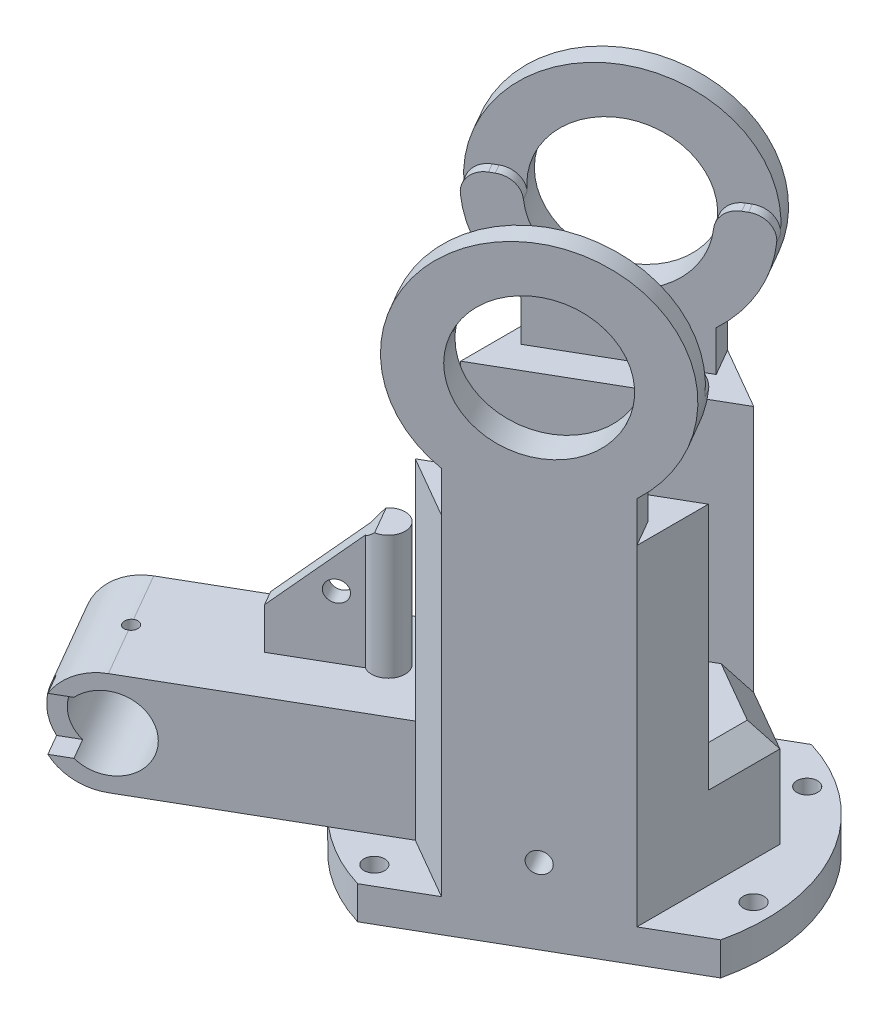
from build123d import *

# Parameters (mm, degrees)
SKETCH4_R            = 55.88
BOSS_EXTRUDE2_DEPTH  = 10.16
BOSS_EXTRUDE4_DEPTH  = 101.6
BOSS_EXTRUDE5_DEPTH  = 9.525
BOSS_EXTRUDE6_START  = -9.525
BOSS_EXTRUDE6_DEPTH  = 9.525
CUT_EXTRUDE4_REACH   = 223.16
SKETCH12_R           = 21.5
SKETCH13_W           = 38.1
SKETCH13_H           = 69.85
CUT_EXTRUDE5_DEPTH   = 76.2
BOSS_EXTRUDE10_DEPTH = 19.05
SKETCH28_R           = 11.2395
CUT_EXTRUDE9_DEPTH   = 38.1
CUT_EXTRUDE10_DEPTH  = 7.366
CHAMFER1_SIZE        = 6.35
SKETCH30_R           = 2.1
CUT_EXTRUDE11_DEPTH  = 7.366
SKETCH31_R           = 3.175
CUT_EXTRUDE12_DEPTH  = 223.900333216
BOSS_EXTRUDE11_DEPTH = 38.1
CHAMFER2_SIZE        = 25.4
CUT_EXTRUDE13_REACH  = 233.204
SKETCH34_R           = 3.175
SKETCH35_R           = 3.175
CUT_EXTRUDE14_DEPTH  = 246.746626534
SKETCH36_W           = 63.5
SKETCH36_H           = 36.709955102
CUT_EXTRUDE15_DEPTH  = 63.5
FILLET1_R            = 6.35
CUT_EXTRUDE16_DEPTH  = 223.900333216


with BuildPart() as part:
    # Sketch4 → Boss-Extrude2 (new body)
    with BuildSketch(Plane(origin=(0, 0, 0), x_dir=(1, 0, 0), z_dir=(0, 1, 0))):
        with Locations(Location((0, 0, 0), (0, 0, 270))):
            Circle(SKETCH4_R)
    extrude(amount=BOSS_EXTRUDE2_DEPTH)

    # Sketch8 → Boss-Extrude4 (add)
    with BuildSketch(Plane(origin=(0, 10.16, 0), x_dir=(1, 0, 0), z_dir=(0, 1, 0))):
        Polygon((0, 43.994090512), (-38.1, 21.997045256), (-38.1, -21.997045256), (0, -43.994090512), (38.1, -21.997045256), (38.1, 21.997045256), align=None)
    extrude(amount=BOSS_EXTRUDE4_DEPTH)

    # Sketch9 → Boss-Extrude5 (add)
    with BuildSketch(Plane(origin=(-19.05, 0, -32.995567884), x_dir=(-0.8660254037844386, 0, 0.5000000000000003), z_dir=(-0.5000000000000002, 0, -0.8660254037844385))):
        with BuildLine():
            Line((21.997045256, 111.76), (-21.997045256, 111.76))
            Line((-21.997045256, 111.76), (-21.997045256, 124.225996336))
            ThreePointArc((-21.997045256, 124.225996336), (0, 188.144153123), (21.997045256, 124.225996336))
            Line((21.997045256, 124.225996336), (21.997045256, 111.76))
        make_face()
    extrude(amount=-BOSS_EXTRUDE5_DEPTH)

    # Sketch10 → Boss-Extrude6 (add)
    with BuildSketch(Plane(origin=(19.05, 0, 32.995567884), x_dir=(0.8660254037844386, 0, -0.5000000000000001), z_dir=(0.5000000000000001, 0, 0.8660254037844386)).offset(BOSS_EXTRUDE6_START)):
        with BuildLine():
            Line((-21.997045256, 111.76), (21.997045256, 111.76))
            Line((21.997045256, 111.76), (21.997045256, 124.225996336))
            ThreePointArc((21.997045256, 124.225996336), (0, 188.144153123), (-21.997045256, 124.225996336))
            Line((-21.997045256, 124.225996336), (-21.997045256, 111.76))
        make_face()
    extrude(amount=BOSS_EXTRUDE6_DEPTH)

    # Cut-Extrude4: up to this face of the body (flat: up to its plane)
    cut_extrude4_end = Plane(part.part.faces().sort_by_distance((19.05, 104.643172711, 32.995567884))[0])
    # Sketch12 → Cut-Extrude4 (cut, up to the picked face)
    with BuildSketch(Plane(origin=(-19.05, 0, -32.995567884), x_dir=(-0.8660254037844386, 0, 0.5000000000000003), z_dir=(-0.5000000000000002, 0, -0.8660254037844385)), mode=Mode.PRIVATE) as cut_extrude4_sk1:
        with Locations((0, 152.4)):
            Circle(SKETCH12_R)
    cut_extrude4_tool1 = split(extrude(cut_extrude4_sk1.sketch, amount=-CUT_EXTRUDE4_REACH, mode=Mode.PRIVATE), bisect_by=cut_extrude4_end, keep=Keep.BOTH, mode=Mode.PRIVATE)
    add(cut_extrude4_tool1.solids().sort_by(Axis((-19.05, 152.4, -32.995568), (0.5000000000000002, 0, 0.8660254037844385)))[0], mode=Mode.SUBTRACT)

    # Sketch13 → Cut-Extrude5 (cut, symmetric)
    with BuildSketch(Plane(origin=(-19.05, 0, 10.998522628), x_dir=(0.5000000000000002, 0, 0.8660254037844386), z_dir=(-0.8660254037844385, 0, 0.5000000000000001))):
        with Locations((0, 76.835)):
            Rectangle(SKETCH13_W, SKETCH13_H)
    extrude(amount=CUT_EXTRUDE5_DEPTH, both=True, mode=Mode.SUBTRACT)

    # Sketch22 → Boss-Extrude10 (add, symmetric)
    with BuildSketch(Plane(origin=(0, 0, 0), x_dir=(-0.8660254037844386, 0, 0.5000000000000001), z_dir=(-0.5000000000000001, 0, -0.8660254037844386))):
        with BuildLine():
            Line((43.994090512, 41.91), (102.10102108, 41.91))
            ThreePointArc((102.10102108, 41.91), (117.97602108, 26.035), (102.10102108, 10.16))
            Line((102.10102108, 10.16), (43.994090512, 10.16))
            Line((43.994090512, 10.16), (21.997045256, 10.16))
            Line((21.997045256, 10.16), (21.997045256, 41.91))
            Line((21.997045256, 41.91), (43.994090512, 41.91))
        make_face()
    extrude(amount=BOSS_EXTRUDE10_DEPTH, both=True)

    # Sketch28 → Cut-Extrude9 (cut)
    with BuildSketch(Plane(origin=(9.525, 0, 16.497783942), x_dir=(0.8660254037844386, 0, -0.5000000000000001), z_dir=(0.5000000000000001, 0, 0.8660254037844386))):
        with Locations((-102.10102108, 26.035)):
            Circle(SKETCH28_R)
    extrude(amount=-CUT_EXTRUDE9_DEPTH, mode=Mode.SUBTRACT)

    # Sketch29 → Cut-Extrude10 (cut)
    with BuildSketch(Plane(origin=(9.525, 0, 16.497783942), x_dir=(0.8660254037844386, 0, -0.5000000000000001), z_dir=(0.5000000000000001, 0, 0.8660254037844386))):
        with BuildLine():
            Line((-115.737415068, 17.907), (-109.863879848, 17.907))
            ThreePointArc((-109.863879848, 17.907), (-113.34052108, 26.035), (-109.863879848, 34.163))
            Line((-109.863879848, 34.163), (-115.737415068, 34.163))
            ThreePointArc((-115.737415068, 34.163), (-117.97602108, 26.035), (-115.737415068, 17.907))
        make_face()
    extrude(amount=-CUT_EXTRUDE10_DEPTH, mode=Mode.SUBTRACT)

    # Chamfer1
    chamfer1_edges = [part.edges().sort_by_distance(p)[0] for p in [
        (38.1, 41.91, -10.998522628),
        (28.575, 41.91, -27.49630657),
    ]]
    chamfer(chamfer1_edges, length=CHAMFER1_SIZE)

    # Sketch30 → Cut-Extrude11 (cut)
    with BuildSketch(Plane(origin=(0, 41.91, 0), x_dir=(1, 0, 0), z_dir=(0, 1, 0))):
        with Locations(Location((-88.422078008, -51.05051054, 0), (0, 0, 270))):
            Circle(SKETCH30_R)
    extrude(amount=-CUT_EXTRUDE11_DEPTH, mode=Mode.SUBTRACT)

    # Sketch31 → Cut-Extrude12 (cut, through all)
    with BuildSketch(Plane(origin=(0, 10.16, 0), x_dir=(1, 0, 0), z_dir=(0, 1, 0))):
        with Locations(Location((-49.089000823, 6.594762938, 0), (0, 0, 270))):
            Circle(SKETCH31_R)
        with Locations(Location((26.925278647, 41.57222955, 0), (0, 0, 270))):
            Circle(SKETCH31_R)
    cut_extrude12 = extrude(amount=-CUT_EXTRUDE12_DEPTH, mode=Mode.SUBTRACT)

    # Mirror1: Cut-Extrude12 across plane
    add(cut_extrude12.mirror(Plane(origin=(0, 0, 0), x_dir=(-0.8660254037844386, 0, 0.5000000000000001), z_dir=(-0.5000000000000001, 0, -0.8660254037844386))), mode=Mode.SUBTRACT)

    # Sketch33 → Boss-Extrude11 (add)
    with BuildSketch(Plane(origin=(0, 41.91, 0), x_dir=(1, 0, 0), z_dir=(0, 1, 0))):
        with BuildLine():
            Line((-43.411916389, -22.079834386), (-63.092428819, -33.442383535))
            Line((-63.092428819, -33.442383535), (-61.800298466, -35.680418955))
            Line((-61.800298466, -35.680418955), (-60.542722832, -37.858603849))
            Line((-60.542722832, -37.858603849), (-40.91541904, -26.504074545))
            ThreePointArc((-40.91541904, -26.504074545), (-33.742060338, -19.539834386), (-43.411916389, -22.079834386))
        make_face()
    extrude(amount=BOSS_EXTRUDE11_DEPTH)

    # Chamfer2
    chamfer2_edges = [part.edges().sort_by_distance(p)[0] for p in [
        (-61.817575825, 80.01, 35.650493692),
    ]]
    chamfer(chamfer2_edges, length=CHAMFER2_SIZE)

    # Cut-Extrude13: up to this plane
    cut_extrude13_end = Plane(origin=(-60.542722832, 80.01, 37.858603849), z_dir=(-0.500750644235671, 0, -0.8655915851587056))
    # Sketch34 → Cut-Extrude13 (cut, up to the surface)
    with BuildSketch(Plane(origin=(-1.292130352, 0, -2.23803542), x_dir=(-0.8660254037844386, 0, 0.5000000000000003), z_dir=(-0.5000000000000002, 0, -0.8660254037844385)), mode=Mode.PRIVATE) as cut_extrude13_sk1:
        with Locations((55.184849848, 61.159110234)):
            Circle(SKETCH34_R)
    cut_extrude13_tool1 = split(extrude(cut_extrude13_sk1.sketch, amount=-CUT_EXTRUDE13_REACH, mode=Mode.PRIVATE), bisect_by=cut_extrude13_end, keep=Keep.BOTH, mode=Mode.PRIVATE)
    add(cut_extrude13_tool1.solids().sort_by_distance((-49.083612, 61.15911, 25.35439))[0], mode=Mode.SUBTRACT)

    # Sketch35 → Cut-Extrude14 (cut, through all)
    with BuildSketch(Plane(origin=(19.05, 0, 32.995567884), x_dir=(0.8660254037844386, 0, -0.5000000000000001), z_dir=(0.5000000000000001, 0, 0.8660254037844386))):
        with Locations((0, 23.280078313)):
            Circle(SKETCH35_R)
    extrude(amount=-CUT_EXTRUDE14_DEPTH, mode=Mode.SUBTRACT)

    # Sketch36 → Cut-Extrude15 (cut, symmetric)
    with BuildSketch(Plane(origin=(-19.05, 0, 10.998522628), x_dir=(0.5000000000000004, 0, 0.8660254037844384), z_dir=(-0.8660254037844384, 0, 0.5000000000000004))):
        with Locations((0, 174.660846527)):
            Rectangle(SKETCH36_W, SKETCH36_H)
    extrude(amount=CUT_EXTRUDE15_DEPTH, both=True, mode=Mode.SUBTRACT)

    # Fillet1
    # the kernel refuses this fillet: 6.35 mm, written as the material it takes off along each edge
    with BuildSketch(Plane(origin=(12.272597523, 156.305868976, -21.027711652), x_dir=(0.04103819462533737, -0.9988766133891899, -0.023693412713994805), z_dir=(-0.5000000000000003, 0, -0.8660254037844386))) as fillet1_piece_1:
        with BuildLine():
            CenterArc((6.655634068, -6.291985478), FILLET1_R, 97.750867839, 84.965214409)
            Line((0.312767573, -6.592891819), (0, 0))
            ThreePointArc((0, 0), (2.899617679, -0.196427123), (5.799235358, 0))
        make_face()
    extrude(amount=19.675766287, mode=Mode.SUBTRACT)
    with BuildSketch(Plane(origin=(-24.346831236, 156.305868976, 0.114525399), x_dir=(-0.04103819462533767, -0.9988766133891899, 0.023693412713994975), z_dir=(-0.5000000000000003, 0, -0.8660254037844386))) as fillet1_piece_2:
        with BuildLine():
            CenterArc((6.655634068, 6.291985478), FILLET1_R, 177.283917752, 84.965214409)
            Line((0.312767573, 6.592891819), (0, 0))
            ThreePointArc((0, 0), (2.899617679, 0.196427123), (5.799235358, 0))
        make_face()
    extrude(amount=19.675766287, mode=Mode.SUBTRACT)
    with BuildSketch(Plane(origin=(-14.894977291, 156.305868976, 45.261361242), x_dir=(-0.011364190914464473, -0.999913899736612, 0.0065611186835884), z_dir=(-0.5000000000000002, 0, -0.8660254037844386)), Plane(origin=(-36.459231913, 156.305868976, 7.91097661), x_dir=(-0.011364190914463116, -0.999913899736612, 0.0065611186835876165), z_dir=(-0.5000000000000002, 0, -0.8660254037844386))) as fillet1_piece_3:
        with BuildLine():
            CenterArc((6.26760006, -6.320536654), FILLET1_R, 84.478464497, 94.769665105)
            Line((-0.081853204, -6.237210446), (0, 0))
            ThreePointArc((0, 0), (3.439298151, 0.165849191), (6.878596303, 0))
        make_face()
    extrude(amount=20.371490756, mode=Mode.SUBTRACT)
    with BuildSketch(Plane(origin=(25.080722669, 156.305868976, -27.619132734), x_dir=(0.011364190914465366, -0.999913899736612, -0.00656111868358885), z_dir=(-0.5000000000000002, 0, -0.8660254037844386)), Plane(origin=(46.644977291, 156.305868976, 9.731251898), x_dir=(0.011364190914466365, -0.999913899736612, -0.006561118683589426), z_dir=(-0.5000000000000002, 0, -0.8660254037844386))) as fillet1_piece_4:
        with BuildLine():
            CenterArc((6.26760006, 6.320536654), FILLET1_R, 180.751870398, 94.769665105)
            Line((-0.081853204, 6.237210446), (0, 0))
            ThreePointArc((0, 0), (3.439298151, -0.165849191), (6.878596303, 0))
        make_face()
    extrude(amount=20.371490756, mode=Mode.SUBTRACT)

    # Sketch37 → Cut-Extrude16 (cut, through all)
    with BuildSketch(Plane(origin=(0, 10.16, 0), x_dir=(1, 0, 0), z_dir=(0, 1, 0))):
        with BuildLine():
            Line((-72.24200472, 2.28514964), (-54.450894057, 12.556852171))
            ThreePointArc((-54.450894057, 12.556852171), (-27.94, 48.393499563), (16.350894057, 53.434283597))
            Line((16.350894057, 53.434283597), (28.91906675, 60.690521485))
            Line((28.91906675, 60.690521485), (-19.05, 57.412021454))
            Line((-19.05, 57.412021454), (-73.371024583, 21.597251022))
            Line((-73.371024583, 21.597251022), (-72.24200472, 5.078102435))
            Line((-72.24200472, 5.078102435), (-72.24200472, 2.28514964))
        make_face()
        with BuildLine():
            Line((-54.450894057, 12.556852171), (-50.005344641, 15.123491323))
            Line((-50.005344641, 15.123491323), (-38.792463926, 21.597251022))
            Line((-38.792463926, 21.597251022), (-38.1, 21.997045256))
            Line((-38.1, 21.997045256), (0, 43.994090512))
            Line((0, 43.994090512), (11.905344641, 50.867644445))
            Line((11.905344641, 50.867644445), (16.350894057, 53.434283597))
            ThreePointArc((16.350894057, 53.434283597), (-27.94, 48.393499563), (-54.450894057, 12.556852171))
        make_face()
        with BuildLine():
            ThreePointArc((-16.350894057, -53.434283597), (27.94, -48.393499563), (54.450894057, -12.556852171))
            Line((54.450894057, -12.556852171), (38.1, -21.997045256))
            Line((38.1, -21.997045256), (19.05, -32.995567884))
            Line((19.05, -32.995567884), (0, -43.994090512))
            Line((0, -43.994090512), (-16.350894057, -53.434283597))
        make_face()
        with BuildLine():
            Line((63.673498956, -7.232178749), (54.450894057, -12.556852171))
            ThreePointArc((54.450894057, -12.556852171), (27.94, -48.393499563), (-16.350894057, -53.434283597))
            Line((-16.350894057, -53.434283597), (-27.007271943, -59.586746239))
            Line((-27.007271943, -59.586746239), (28.91906675, -77.707339719))
            Line((28.91906675, -77.707339719), (77.1233643, -25.432245504))
            Line((77.1233643, -25.432245504), (71.516001253, -6.077798857))
            Line((71.516001253, -6.077798857), (63.673498956, -7.232178749))
        make_face()
    extrude(amount=-CUT_EXTRUDE16_DEPTH, mode=Mode.SUBTRACT)


solid = part.part
